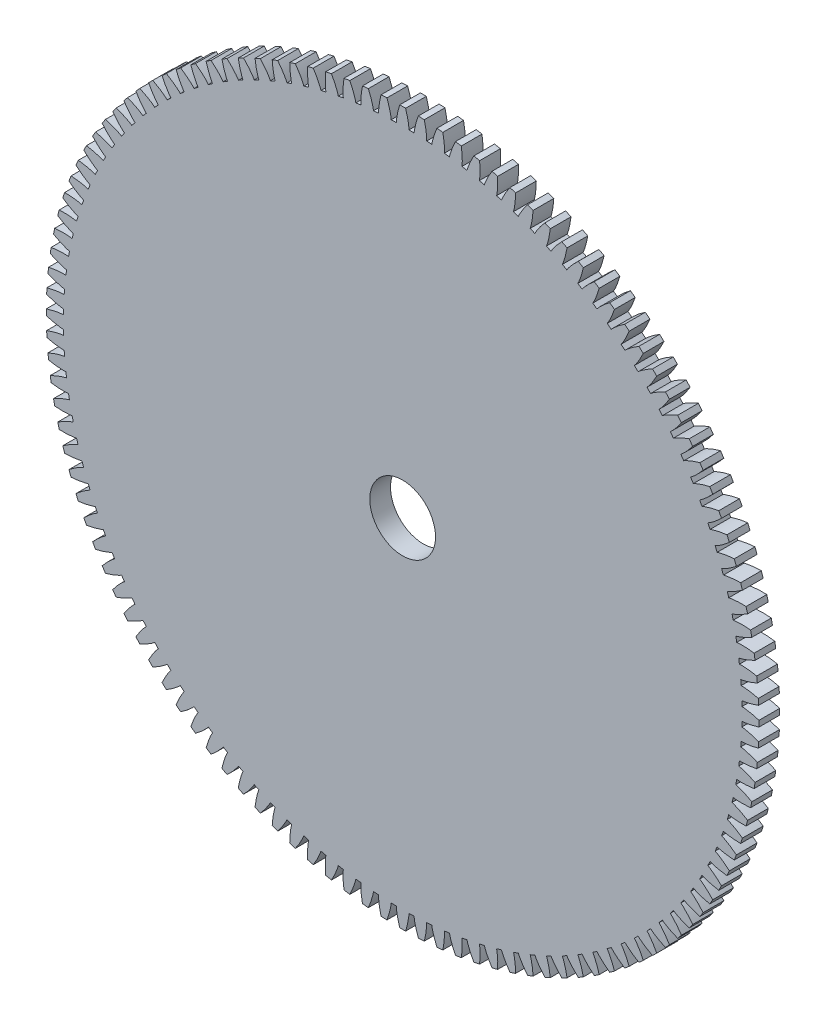
from build123d import *

# Parameters (mm, degrees)
SKETCH1_R               = 51.646666667
BOSS_EXTRUDE1_DEPTH     = 3
CUT_EXTRUDE2_DEPTH      = 4
CIRPATTERN1_COUNT       = 120
CUT_EXTRUDE4_DEPTH      = 5
CUT_EXTRUDE4_DEPTH_BACK = 5
SKETCH3_R               = 4.7625


with BuildPart() as part:
    # Sketch1 → Boss-Extrude1 (new body)
    with BuildSketch(Plane.XY):
        Circle(SKETCH1_R)
    extrude(amount=BOSS_EXTRUDE1_DEPTH)

    # Sketch2 → Cut-Extrude2 (cut, symmetric)
    with BuildSketch(Plane.XY):
        with BuildLine():
            add(Edge.make_bspline(
                [(49.173361018, 0.916442431), (49.183840602, 0.916566665), (49.203665365, 0.916389813), (49.236041926, 0.915655791), (49.281069694, 0.913831661), (49.33450746, 0.91092478), (49.39754984, 0.906541319), (49.46694205, 0.9007175), (49.542570565, 0.893292721), (49.618148152, 0.884920911), (49.693668139, 0.875669614), (49.769018239, 0.865640937), (49.860443198, 0.852529408), (49.970286862, 0.835466838), (50.09901943, 0.813561626), (50.245444787, 0.786397303), (50.395173533, 0.75621663), (50.542926329, 0.724464568), (50.692735681, 0.690005727), (50.838058859, 0.654980196), (50.989598467, 0.616143688), (51.129772554, 0.579049351), (51.287526439, 0.534752027), (51.415036199, 0.498206693), (51.547379052, 0.458157155), (51.61188554, 0.438324841), (51.644892822, 0.428045758)],
                knots=[0, 0, 0, 0, 0, 0.015083688, 0.02853182, 0.04661014, 0.06485485, 0.092110526, 0.119476176, 0.146842496, 0.174208854, 0.201574956, 0.228941013, 0.256307345, 0.307035032, 0.361767352, 0.416499661, 0.471231937, 0.525964282, 0.580696616, 0.635428982, 0.690161387, 0.744893688, 0.799626082, 0.854358407, 0.909090914, 0.909090914, 0.909090914, 0.909090914, 0.909090914], degree=4))
            Line((51.644892822, 0.428045758), (59.997939254, 0.497277891))
            add(Edge.make_bspline(
                [(59.997939254, 0.497277891), (59.997762721, 0.518577016), (59.99738986, 0.560060691), (59.996393061, 0.664567115), (59.995381809, 0.744521068), (59.99390127, 0.860121464), (59.992423545, 0.954281965), (59.990665516, 1.06137839), (59.988796095, 1.160669103), (59.986716856, 1.264630009), (59.984481052, 1.365844925), (59.982066985, 1.468568948), (59.979470379, 1.570617707), (59.976722607, 1.672662508), (59.973757206, 1.775372094), (59.970692767, 1.876565311), (59.967328262, 1.980492562), (59.963998646, 2.079745038), (59.960149273, 2.186786699), (59.956696993, 2.280895494), (59.952125445, 2.396414949), (59.948950845, 2.476312253), (59.944476834, 2.580727623), (59.942678097, 2.622173961), (59.941739677, 2.643453134)],
                knots=[0.083333333, 0.083333333, 0.083333333, 0.083333333, 0.083333333, 0.123015873, 0.162698413, 0.202380952, 0.242063492, 0.281746032, 0.321428571, 0.361111111, 0.400793651, 0.44047619, 0.48015873, 0.51984127, 0.55952381, 0.599206349, 0.638888889, 0.678571429, 0.718253968, 0.757936508, 0.797619048, 0.837301587, 0.876984127, 0.916666667, 0.916666667, 0.916666667, 0.916666667, 0.916666667], degree=4))
            Line((59.941739677, 2.643453134), (51.596517475, 2.275425715))
            add(Edge.make_bspline(
                [(49.153933526, 1.658348392), (49.16440525, 1.658772788), (49.184193589, 1.659986945), (49.216487364, 1.662414419), (49.261357955, 1.66659262), (49.314570351, 1.672292235), (49.377296922, 1.679969072), (49.446289237, 1.689416617), (49.521425523, 1.70078931), (49.596461386, 1.713105072), (49.671393701, 1.726296102), (49.746115675, 1.740254554), (49.836729135, 1.758132927), (49.945529276, 1.780920887), (50.072938991, 1.80953342), (50.217742006, 1.844323827), (50.365686019, 1.882299335), (50.511574551, 1.921740666), (50.659375158, 1.963992699), (50.802666081, 2.006575856), (50.951965464, 2.05329011), (51.090006079, 2.097669755), (51.245225426, 2.150162571), (51.370647802, 2.193331167), (51.500713253, 2.240252108), (51.564093394, 2.263433252), (51.596517475, 2.275425715)],
                knots=[0, 0, 0, 0, 0, 0.015083688, 0.02853182, 0.04661014, 0.06485485, 0.092110526, 0.119476176, 0.146842496, 0.174208854, 0.201574956, 0.228941013, 0.256307345, 0.307035032, 0.361767352, 0.416499661, 0.471231937, 0.525964282, 0.580696616, 0.635428982, 0.690161387, 0.744893688, 0.799626082, 0.854358407, 0.909090914, 0.909090914, 0.909090914, 0.909090914, 0.909090914], degree=4))
            Line((49.153933526, 1.658348392), (49.173361018, 0.916442431))
        make_face()
    cut_extrude2 = extrude(amount=CUT_EXTRUDE2_DEPTH, both=True, mode=Mode.SUBTRACT)

    # CirPattern1: Cut-Extrude2 ×120 about axis
    cirpattern1_axis = Axis((0, 0, -0.15), (0, 0, 1))
    for i in range(1, CIRPATTERN1_COUNT):
        add(cut_extrude2.rotate(cirpattern1_axis, i * 360 / CIRPATTERN1_COUNT), mode=Mode.SUBTRACT)

    # Sketch3 → Cut-Extrude4 (cut, two sides: drawn at the far end of the back side and taken through both)
    with BuildSketch(Plane.XY.offset(-CUT_EXTRUDE4_DEPTH_BACK)):
        Circle(SKETCH3_R)
    extrude(amount=CUT_EXTRUDE4_DEPTH + CUT_EXTRUDE4_DEPTH_BACK, mode=Mode.SUBTRACT)


solid = part.part
